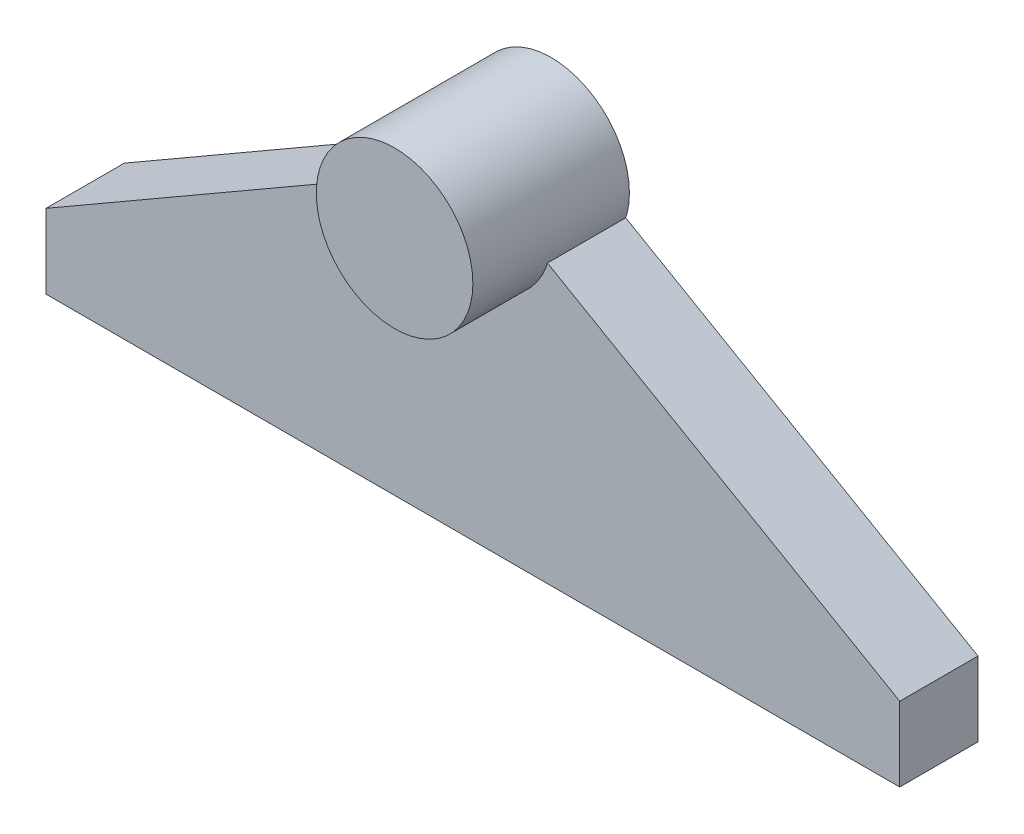
from build123d import *

# Parameters (mm, degrees)
SKETCH1_R             = 100
BOSS_EXTRUDE1_DEPTH   = 200
EXTRUDE_THIN1_DEPTH   = 100
EXTRUDE_THIN1_2_DEPTH = 1
EXTRUDE_THIN1_START   = 99
EXTRUDE_THIN1_3_DEPTH = 1


# Read off the part's stored shape, not the designer's step: Extrude-Thin1
with BuildPart() as part:
    # Sketch1 → Boss-Extrude1 (new body)
    with BuildSketch(Plane.XY):
        Circle(SKETCH1_R)
    extrude(amount=BOSS_EXTRUDE1_DEPTH)


with BuildPart() as body_2:
    # Extrude-Thin1 outline → Extrude-Thin1 (new body)
    with BuildSketch(Plane.XY):
        with BuildLine():
            Line((545.26106063, -289.558376275), (68.521185658, -14.312481126))
            ThreePointArc((68.521185658, -14.312481126), (0, -70), (-68.521185658, -14.312481126))
            Line((-68.521185658, -14.312481126), (-545.26106063, -289.558376275))
            Line((-545.26106063, -289.558376275), (-545.26106063, -384.491692362))
            Line((-545.26106063, -384.491692362), (545.26106063, -384.491692362))
            Line((545.26106063, -384.491692362), (545.26106063, -289.558376275))
        make_face()
        with BuildLine():
            ThreePointArc((-82.248358738, -56.87888435), (0, -100), (82.248358738, -56.87888435))
            Line((82.248358738, -56.87888435), (515.26106063, -306.87888435))
            Line((515.26106063, -306.87888435), (515.26106063, -354.491692362))
            Line((515.26106063, -354.491692362), (-515.26106063, -354.491692362))
            Line((-515.26106063, -354.491692362), (-515.26106063, -306.87888435))
            Line((-515.26106063, -306.87888435), (-82.248358738, -56.87888435))
        make_face(mode=Mode.SUBTRACT)
    extrude(amount=EXTRUDE_THIN1_DEPTH)

    # Extrude-Thin1 2 outline → Extrude-Thin1 2 (add)
    with BuildSketch(Plane.XY):
        with BuildLine():
            Line((515.26106063, -306.87888435), (82.248358738, -56.87888435))
            ThreePointArc((82.248358738, -56.87888435), (0, -100), (-82.248358738, -56.87888435))
            Line((-82.248358738, -56.87888435), (-515.26106063, -306.87888435))
            Line((-515.26106063, -306.87888435), (-515.26106063, -354.491692362))
            Line((-515.26106063, -354.491692362), (515.26106063, -354.491692362))
            Line((515.26106063, -354.491692362), (515.26106063, -306.87888435))
        make_face()
    extrude(amount=EXTRUDE_THIN1_2_DEPTH)

    # Extrude-Thin1 3 outline → Extrude-Thin1 3 (add)
    with BuildSketch(Plane.XY.offset(EXTRUDE_THIN1_START)):
        with BuildLine():
            Line((515.26106063, -306.87888435), (82.248358738, -56.87888435))
            ThreePointArc((82.248358738, -56.87888435), (0, -100), (-82.248358738, -56.87888435))
            Line((-82.248358738, -56.87888435), (-515.26106063, -306.87888435))
            Line((-515.26106063, -306.87888435), (-515.26106063, -354.491692362))
            Line((-515.26106063, -354.491692362), (515.26106063, -354.491692362))
            Line((515.26106063, -354.491692362), (515.26106063, -306.87888435))
        make_face()
    extrude(amount=EXTRUDE_THIN1_3_DEPTH)


solid = Compound([part.part, body_2.part])
